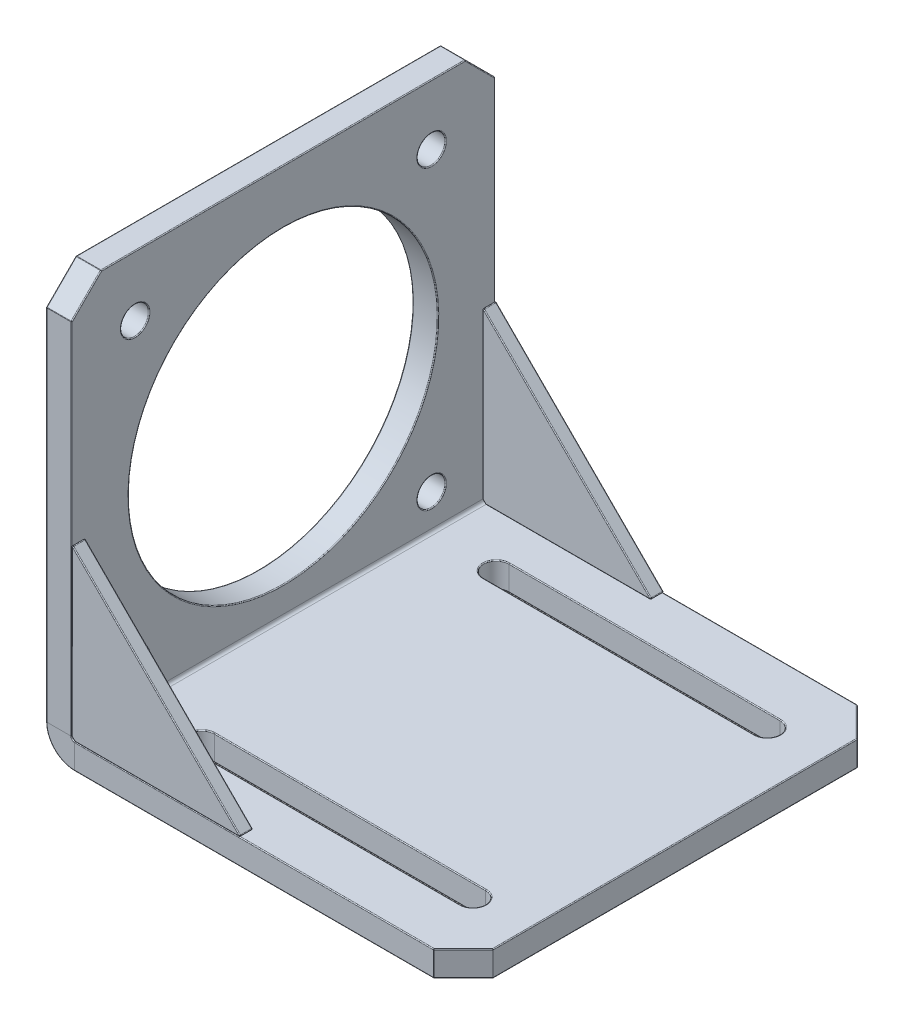
from build123d import *

# Parameters (mm, degrees)
SCHIZZO1_W                     = 98.5
SCHIZZO1_H                     = 6
BASE_FLANGIA1_DEPTH            = 50
BORDO_FLANGIA1_STRIP_W         = 25.4732
BORDO_FLANGIA1_STRIP_H         = 6
BORDO_FLANGIA1_STRIP_CUT_DEPTH = 100
BORDO_FLANGIA1_DEPTH           = 100
SCHIZZO10_R                    = 36.5
SCHIZZO10_R_2                  = 3.3
TAGLIO_ESTRUSIONE1_DEPTH       = 141.044635742
TAGLIO_ESTRUSIONE3_DEPTH       = 145.078103819
ESTRUSIONE_ESTRUSIONE3_START   = 50
ESTRUSIONE_ESTRUSIONE3_DEPTH   = 3
SMUSSO1_SIZE                   = 7
RACCORDO1_R                    = 0.2
RACCORDO2_R                    = 0.2
RACCORDO3_R                    = 0.2


# Sheet-metal steps are written as plain solids
with BuildPart() as part:
    # Schizzo1 → Base-Flangia1 (new, symmetric)
    with BuildSketch(Plane.XY):
        with Locations((49.25, -3)):
            Rectangle(SCHIZZO1_W, SCHIZZO1_H)
    extrude(amount=BASE_FLANGIA1_DEPTH, both=True)

    # Bordo-Flangia1 strip (across the edge) → Bordo-Flangia1 strip cut (cut)
    with BuildSketch(Plane.XY.offset(-50)):
        with Locations((-6, -3)):
            Rectangle(BORDO_FLANGIA1_STRIP_W, BORDO_FLANGIA1_STRIP_H)
    extrude(amount=BORDO_FLANGIA1_STRIP_CUT_DEPTH, mode=Mode.SUBTRACT)

    # Bordo-Flangia1 section (across the edge) → Bordo-Flangia1 (add)
    with BuildSketch(Plane.XY.offset(-50)):
        with BuildLine():
            Line((0, 0.7366), (0, 92.5))
            Line((0, 92.5), (6, 92.5))
            Line((6, 92.5), (6, 0.7366))
            ThreePointArc((6, 0.7366), (6.215745145, 0.215745145), (6.7366, 0))
            Line((6.7366, 0), (6.7366, -6))
            ThreePointArc((6.7366, -6), (1.973104458, -4.026895542), (0, 0.7366))
        make_face()
    extrude(amount=BORDO_FLANGIA1_DEPTH)

    # Schizzo10 → Taglio-Estrusione1 (cut, through all)
    with BuildSketch(Plane(origin=(6, 0, 0), x_dir=(0, 0, -1), z_dir=(1, 0, 0))):
        with Locations(Location((0, 43.25, 0), (0, 0, 90))):
            Circle(SCHIZZO10_R)
        with Locations(Location((-35, 78.25, 0), (0, 0, 90))):
            Circle(SCHIZZO10_R_2)
        with Locations(Location((35, 78.25, 0), (0, 0, 270))):
            Circle(SCHIZZO10_R_2)
        with Locations(Location((-35, 8.25, 0), (0, 0, 270))):
            Circle(SCHIZZO10_R_2)
        with Locations(Location((35, 8.25, 0), (0, 0, 90))):
            Circle(SCHIZZO10_R_2)
    extrude(amount=-TAGLIO_ESTRUSIONE1_DEPTH, mode=Mode.SUBTRACT)

    # Schizzo12 → Taglio-Estrusione3 (cut, through all)
    with BuildSketch(Plane(origin=(0, 0, 0), x_dir=(1, 0, 0), z_dir=(0, 1, 0))):
        with BuildLine():
            Line((85.5, 31.75), (21.5, 31.75))
            ThreePointArc((21.5, 31.75), (18.5, 34.75), (21.5, 37.75))
            Line((21.5, 37.75), (85.5, 37.75))
            ThreePointArc((85.5, 37.75), (88.5, 34.75), (85.5, 31.75))
        make_face()
        with BuildLine():
            Line((85.5, -37.75), (21.5, -37.75))
            ThreePointArc((21.5, -37.75), (18.5, -34.75), (21.5, -31.75))
            Line((21.5, -31.75), (85.5, -31.75))
            ThreePointArc((85.5, -31.75), (88.5, -34.75), (85.5, -37.75))
        make_face()
    extrude(amount=-TAGLIO_ESTRUSIONE3_DEPTH, mode=Mode.SUBTRACT)

    # Smusso1
    smusso1_edges = [part.edges().sort_by_distance(p)[0] for p in [
        (3, 92.5, -50),
        (3, 92.5, 50),
        (98.5, -3, -50),
        (98.5, -3, 50),
    ]]
    chamfer(smusso1_edges, length=SMUSSO1_SIZE)

    # Raccordo1
    raccordo1_edges = [part.edges().sort_by_distance(p)[0] for p in [
        (98.5, 0, 0),
        (98.5, -6, 0),
        (98.5, -3, -43),
        (98.5, -3, 43),
        (95, -6, -46.5),
        (95, -6, 46.5),
        (91.5, -3, 50),
        (95, 0, -46.5),
        (95, 0, 46.5),
        (91.5, -3, -50),
        (0, 43.1183, -50),
        (6, 43.1183, -50),
        (3, 85.5, -50),
        (6, 92.5, 0),
        (49.1183, -6, -50),
        (6, 89, 46.5),
        (6, 89, -46.5),
        (0, 92.5, 0),
        (3, 92.5, 43),
        (3, 92.5, -43),
        (49.1183, 0, -50),
        (0, 89, 46.5),
        (0, 89, -46.5),
        (3, 85.5, 50),
        (49.1183, -6, 50),
        (49.1183, 0, 50),
        (1.973104458, -4.026895542, -50),
        (1.973104458, -4.026895542, 50),
        (6.215745145, 0.215745145, -50),
        (6.215745145, 0.215745145, 50),
        (6, 43.1183, 50),
        (0, 43.1183, 50),
        (0, 4.95, -35),
        (6, 4.95, -35),
        (0, 11.55, 35),
        (6, 11.55, 35),
        (0, 81.55, -35),
        (6, 81.55, -35),
        (0, 74.95, 35),
        (6, 74.95, 35),
        (0, 6.75, 0),
        (6, 6.75, 0),
        (88.5, -6, -34.75),
        (53.5, -6, -31.75),
        (18.5, -6, -34.75),
        (53.5, -6, -37.75),
        (88.5, 0, -34.75),
        (53.5, 0, -37.75),
        (18.5, 0, -34.75),
        (53.5, 0, -31.75),
        (88.5, -6, 34.75),
        (53.5, -6, 37.75),
        (18.5, -6, 34.75),
        (53.5, -6, 31.75),
        (88.5, 0, 34.75),
        (53.5, 0, 31.75),
        (18.5, 0, 34.75),
        (53.5, 0, 37.75),
    ]]
    fillet(raccordo1_edges, radius=RACCORDO1_R)


with BuildPart() as body_2:
    # Schizzo15 → Estrusione-Estrusione3 (new body)
    with BuildSketch(Plane.XY.offset(ESTRUSIONE_ESTRUSIONE3_START)):
        Polygon((6, 40), (46, 0), (6.7366, 0), (6, 0.7366), align=None)
    extrude(amount=-ESTRUSIONE_ESTRUSIONE3_DEPTH)


with BuildPart() as body_3:
    # Specchia5: mirrored copy
    add(body_2.part.mirror(Plane.XY))

    # Raccordo2
    raccordo2_edges = [body_3.edges().sort_by_distance(p)[0] for p in [
        (6, 20.3683, -47),
        (6.3683, 0.3683, -47),
        (26.3683, 0, -47),
        (6.3683, 0.3683, -50),
        (6, 20.3683, -50),
        (26, 20, -50),
        (26.3683, 0, -50),
        (26, 20, -47),
        (6, 40, -48.5),
        (46, 0, -48.5),
    ]]
    fillet(raccordo2_edges, radius=RACCORDO2_R)


with BuildPart() as body_2_1:
    add(body_2.part)

    # Raccordo3
    raccordo3_edges = [body_2_1.edges().sort_by_distance(p)[0] for p in [
        (6, 20.3683, 47),
        (6.3683, 0.3683, 47),
        (26.3683, 0, 47),
        (6.3683, 0.3683, 50),
        (6, 20.3683, 50),
        (26, 20, 50),
        (26.3683, 0, 50),
        (26, 20, 47),
        (6, 40, 48.5),
        (46, 0, 48.5),
    ]]
    fillet(raccordo3_edges, radius=RACCORDO3_R)


solid = Compound([part.part, body_3.part, body_2_1.part])
